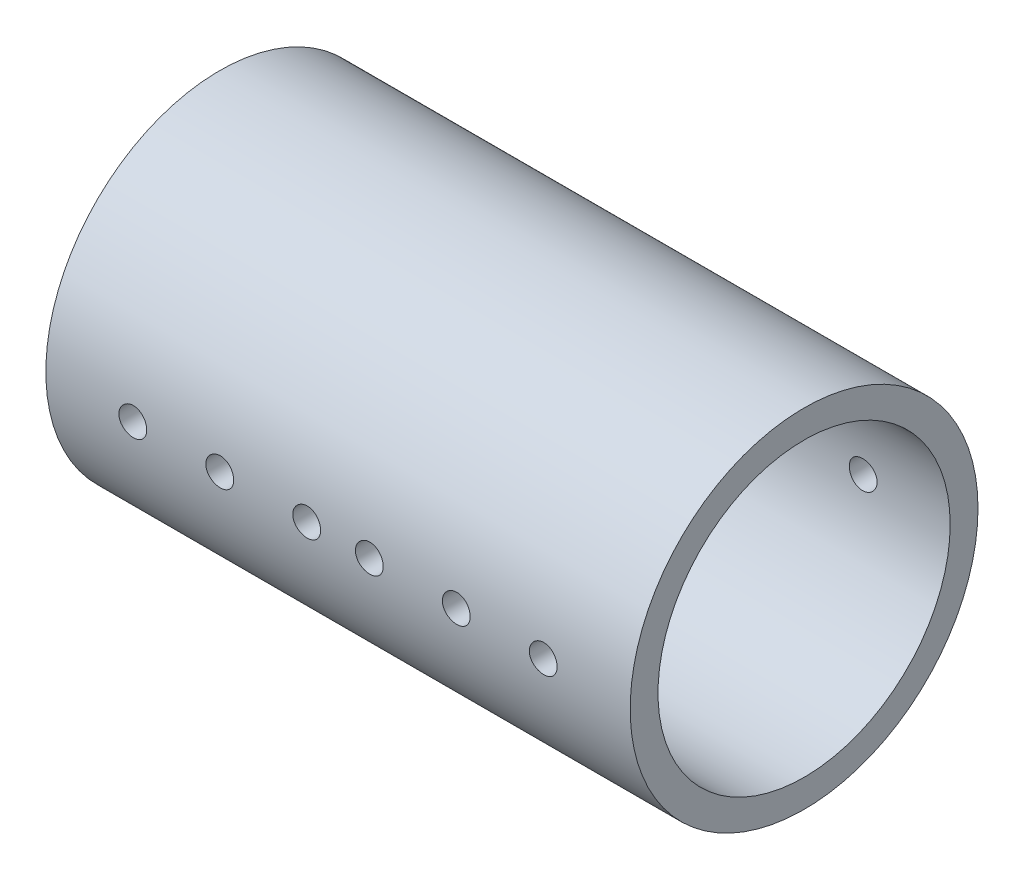
from build123d import *

# Parameters (mm, degrees)
SKETCH_2_R               = 25
SKETCH_2_R_2             = 21
EXTRUDE_2_DEPTH          = 84
CUT_EXTRUDE_2_DEPTH      = 10
CUT_EXTRUDE_2_DEPTH_BACK = 101.900941522
SKETCH_4_R               = 2


with BuildPart() as part:
    # Эскиз2 → Бобышка-Вытянуть2 (new body)
    with BuildSketch(Plane(origin=(0, 0, 0), x_dir=(0, 0, -1), z_dir=(1, 0, 0))):
        Circle(SKETCH_2_R)
        Circle(SKETCH_2_R_2, mode=Mode.SUBTRACT)
    extrude(amount=EXTRUDE_2_DEPTH)

    # Эскиз4 → Вырез-Вытянуть2 (cut, two sides: drawn at the far end of the back side and taken through both)
    with BuildSketch(Plane.XY.offset(25).offset(-CUT_EXTRUDE_2_DEPTH_BACK)):
        with Locations((12.5, 0)):
            Circle(SKETCH_4_R)
        with Locations((71.5, 0)):
            Circle(SKETCH_4_R)
        with Locations((25, 0)):
            Circle(SKETCH_4_R)
        with Locations((37.5, 0)):
            Circle(SKETCH_4_R)
        with Locations((59, 0)):
            Circle(SKETCH_4_R)
        with Locations((46.5, 0)):
            Circle(SKETCH_4_R)
    extrude(amount=CUT_EXTRUDE_2_DEPTH + CUT_EXTRUDE_2_DEPTH_BACK, mode=Mode.SUBTRACT)


solid = part.part
